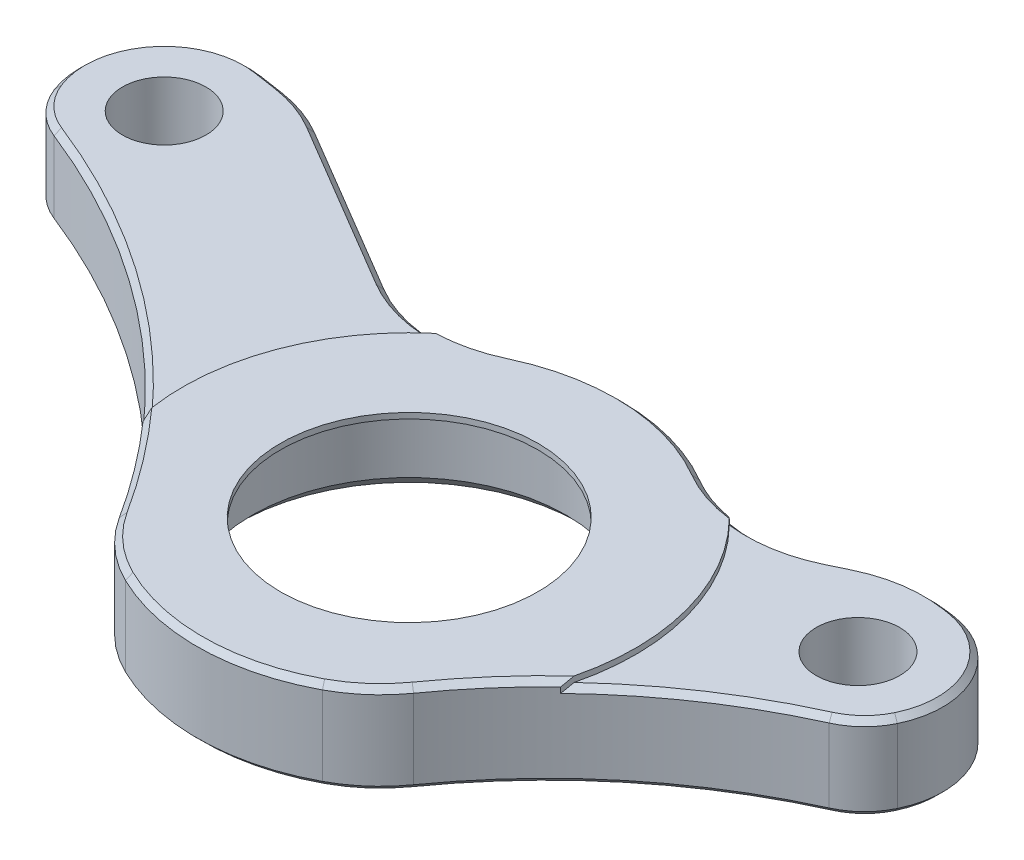
from build123d import *
from build123d.topology import SkipClean

# Parameters (mm, degrees)
SKETCH1_R           = 11.1
SKETCH1_R_2         = 2.95
BOSS_EXTRUDE1_DEPTH = 6.4
CUT_EXTRUDE4_REACH  = 48.556
CHAMFER1_SIZE       = 1
CUT_EXTRUDE3_DEPTH  = 47.555734529
FILLET1_R           = 10
FILLET2_R           = 5
SKETCH7_R           = 11.1
SKETCH7_R_2         = 9.1
BOSS_EXTRUDE2_DEPTH = 0.4
SKETCH9_OUTSIDE_W   = 87.68
SKETCH9_OUTSIDE_H   = 55.695
SKETCH9_OUTSIDE_R   = 16
CUT_EXTRUDE5_DEPTH  = 0.4
CUT_EXTRUDE6_DEPTH  = 0.15
CHAMFER2_SIZE       = 0.4


with BuildPart() as part:
    # Sketch1 → Boss-Extrude1 (new body)
    with BuildSketch(Plane(origin=(0, 0, 0), x_dir=(1, 0, 0), z_dir=(0, 1, 0))):
        with BuildLine():
            Line((-9.621787606, -11.507441213), (-37.944538575, 12.174234774))
            ThreePointArc((-37.944538575, 12.174234774), (-39.566706632, 19.240834224), (-33.200130557, 22.709979086))
            Line((-33.200130557, 22.709979086), (24.561921844, 13.989417946))
            ThreePointArc((24.561921844, 13.989417946), (29.443583706, 9.675962035), (27.514943911, 3.453673633))
            Line((27.514943911, 3.453673633), (9.621787606, -11.507441213))
            ThreePointArc((9.621787606, -11.507441213), (0, -15), (-9.621787606, -11.507441213))
        make_face()
        Circle(SKETCH1_R, mode=Mode.SUBTRACT)
        with Locations((-34.095823533, 16.777211259)):
            Circle(SKETCH1_R_2, mode=Mode.SUBTRACT)
        with Locations((23.666228869, 8.056650118)):
            Circle(SKETCH1_R_2, mode=Mode.SUBTRACT)
    extrude(amount=BOSS_EXTRUDE1_DEPTH)

    # Sketch6 → Cut-Extrude4 (cut, up to next)
    with BuildSketch(Plane(origin=(0, 6.4, 0), x_dir=(1, 0, 0), z_dir=(0, 1, 0)), mode=Mode.PRIVATE) as cut_extrude4_sk1:
        with BuildLine():
            Line((-10.397549699, 10.811612287), (-29.542980034, 22.157844884))
            Line((-29.542980034, 22.157844884), (21.066082003, 14.517198449))
            Line((21.066082003, 14.517198449), (11.313303216, 9.849323344))
            ThreePointArc((11.313303216, 9.849323344), (0.664192087, 14.985287747), (-10.397549699, 10.811612287))
        make_face()
    cut_extrude4_tool1 = extrude(cut_extrude4_sk1.sketch, amount=-CUT_EXTRUDE4_REACH, mode=Mode.PRIVATE) & part.part
    add(cut_extrude4_tool1.solids().sort_by_distance((-4.90649, 6.4, -15.955418))[0], mode=Mode.SUBTRACT)

    # Chamfer1
    chamfer1_edges = [part.edges().sort_by_distance(p)[0] for p in [
        (-11.1, 6.4, 0),
    ]]
    chamfer(chamfer1_edges, length=CHAMFER1_SIZE)

    # Sketch5 → Cut-Extrude3 (cut, through all)
    with BuildSketch(Plane(origin=(0, 6.4, 0), x_dir=(1, 0, 0), z_dir=(0, 1, 0))):
        with BuildLine():
            Line((-37.944538575, 12.174234774), (-9.621787606, -11.507441213))
            ThreePointArc((-9.621787606, -11.507441213), (-21.736768022, 2.78083918), (-37.944538575, 12.174234774))
        make_face()
        with BuildLine():
            Line((9.621787606, -11.507441213), (27.514943911, 3.453673633))
            ThreePointArc((27.514943911, 3.453673633), (17.45368355, -2.69374898), (9.621787606, -11.507441213))
        make_face()
    extrude(amount=-CUT_EXTRUDE3_DEPTH, mode=Mode.SUBTRACT)

    # Fillet1
    fillet1_edges = [part.edges().sort_by_distance(p)[0] for p in [
        (9.621787606, 3.2, 11.507441213),
        (-9.621787606, 3.2, 11.507441213),
        (21.066082003, 3.2, -14.517198449),
        (11.313303216, 3.2, -9.849323344),
        (-10.397549699, 3.2, -10.811612287),
        (-29.542980034, 3.2, -22.157844884),
    ]]
    fillet(fillet1_edges, radius=FILLET1_R)

    # Fillet2
    fillet2_edges = [part.edges().sort_by_distance(p)[0] for p in [
        (27.514943911, 3.2, -3.453673633),
        (-37.944538575, 3.2, -12.174234774),
    ]]
    fillet(fillet2_edges, radius=FILLET2_R)

    # Sketch7 → Boss-Extrude2 (add)
    with BuildSketch(Plane.XZ):
        Circle(SKETCH7_R)
        Circle(SKETCH7_R_2, mode=Mode.SUBTRACT)
    extrude(amount=-BOSS_EXTRUDE2_DEPTH)

    # Sketch9 outside → Cut-Extrude5 (cut)
    with BuildSketch(Plane.XZ):
        with Locations((-5.215, -3.8885)):
            Rectangle(SKETCH9_OUTSIDE_W, SKETCH9_OUTSIDE_H)
        Circle(SKETCH9_OUTSIDE_R, mode=Mode.SUBTRACT)
    extrude(amount=-CUT_EXTRUDE5_DEPTH, mode=Mode.SUBTRACT)

    # Sketch10 → Cut-Extrude6 (cut)
    with SkipClean():  # the faces are left unmerged after this step: merging them gives an invalid solid
        with BuildSketch(Plane.XZ.offset(-0.4)):
            with BuildLine():
                Line((-33.200130557, -22.709979086), (-31.471010975, -22.448927195))
                ThreePointArc((-31.471010975, -22.448927195), (-29.606213483, -21.980449689), (-27.865545183, -21.16373999))
                Line((-27.865545183, -21.16373999), (-15.778990975, -14.000837254))
                ThreePointArc((-15.778990975, -14.000837254), (-12.899787471, -12.852921242), (-9.807384948, -12.641803688))
                ThreePointArc((-9.807384948, -12.641803688), (-14.988647226, -5.59825458), (-15.693394103, 3.11727149))
                ThreePointArc((-15.693394103, 3.11727149), (-25.389120558, -5.583543581), (-36.859243696, -11.759915461))
                ThreePointArc((-36.859243696, -11.759915461), (-38.564746422, -12.878937509), (-39.681392394, -14.585996871))
                ThreePointArc((-39.681392394, -14.585996871), (-38.786079998, -20.519068323), (-33.200130557, -22.709979086))
            make_face()
        extrude(amount=-CUT_EXTRUDE6_DEPTH, mode=Mode.SUBTRACT)

    # Chamfer2
    chamfer2_edges = [part.edges().sort_by_distance(p)[0] for p in [
        (9.181258422, 0, -12.186693797),
        (0.664192087, 0, -14.985287747),
        (-8.067073348, 0, -12.95119066),
        (12.787484872, 0, 7.295073573),
        (8.973593298, 0, 11.909370886),
        (0.284328537, 0, 14.997305001),
        (-8.853535866, 0, 11.952551059),
        (-13.030899461, 0, 6.394129067),
        (-8.853535866, 6.4, 11.952551059),
        (0.284328537, 6.4, 14.997305001),
        (-22.030616875, 6.4, -3.024808286),
        (8.973593298, 6.4, 11.909370886),
        (-38.564746422, 6.4, -12.878937509),
        (17.688730274, 6.4, 2.498737743),
        (-38.786079998, 6.4, -20.519068323),
        (28.054256045, 6.4, -4.038174832),
        (-32.335570766, 6.4, -22.579453141),
        (28.974894193, 6.4, -10.852731747),
        (-29.606213483, 6.4, -21.980449689),
        (24.33317404, 6.4, -14.023952889),
        (-21.822268079, 6.4, -17.582288622),
        (21.134254432, 6.4, -14.06081124),
        (-11.148337367, 6.4, -12.614536482),
        (17.625106381, 6.4, -12.870278654),
        (0.664192087, 6.4, -14.985287747),
        (12.220655249, 6.4, -11.578753904),
        (13.986327713, 0.4, -11.661249433),
        (17.625106381, 0.4, -12.870278654),
        (21.134254432, 0.4, -14.06081124),
        (20.643800798, 0.4, 0.286607853),
        (28.054256045, 0.4, -4.038174832),
        (28.974894193, 0.4, -10.852731747),
        (24.33317404, 0.4, -14.023952889),
        (-25.389120558, 0.55, -5.583543581),
        (-38.564746422, 0.55, -12.878937509),
        (-38.786079998, 0.55, -20.519068323),
        (-32.335570766, 0.55, -22.579453141),
        (-29.606213483, 0.55, -21.980449689),
        (-12.899787471, 0.55, -12.852921242),
        (-21.822268079, 0.55, -17.582288622),
    ]]
    chamfer(chamfer2_edges, length=CHAMFER2_SIZE)


with BuildPart() as body_2:
    # Mirror1: mirrored copy
    add(part.part.mirror(Plane.ZX))


solid = body_2.part
